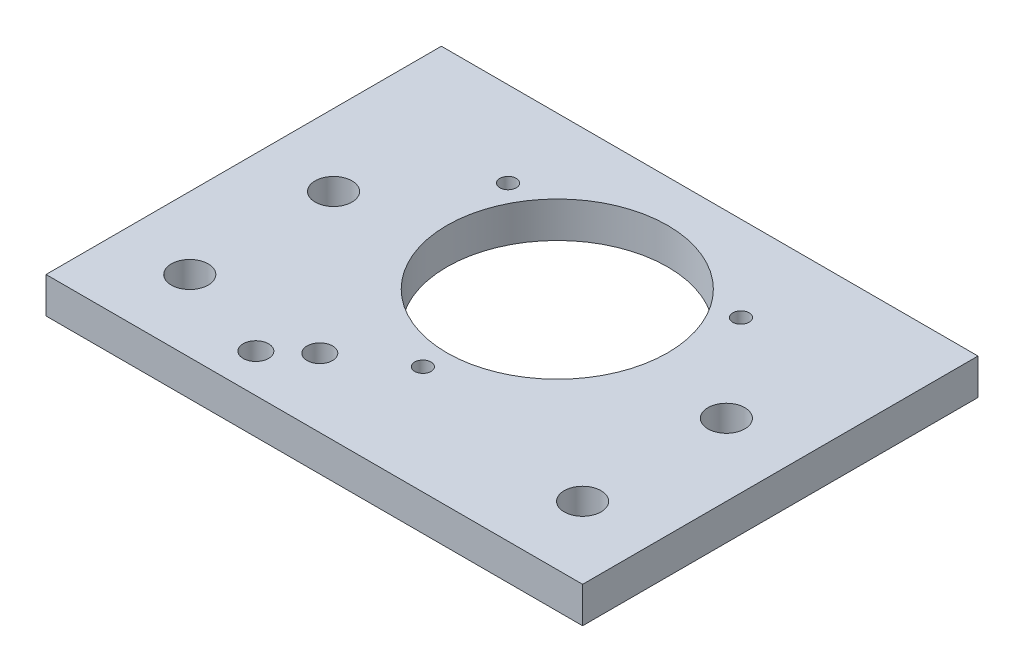
from build123d import *

# Parameters (mm, degrees)
SKETCH1_R           = 3.25755
SKETCH1_R_2         = 2.25
SKETCH1_R_3         = 1.45
SKETCH1_R_4         = 19.5
BOSS_EXTRUDE1_DEPTH = 6.35
SKETCH4_R           = 2.25
CUT_EXTRUDE2_DEPTH  = 3


with BuildPart() as part:
    # Sketch1 → Boss-Extrude1 (new body)
    with BuildSketch(Plane(origin=(0, 0, 0), x_dir=(1, 0, 0), z_dir=(0, 1, 0))):
        Polygon((47.4, 34.925), (-47.4, 34.925), (-47.4, -9.525), (-47.4, -34.925), (-22, -34.925), (47.4, -34.925), align=None)
        with Locations((-34.7, -22.225)):
            Circle(SKETCH1_R, mode=Mode.SUBTRACT)
        with Locations((-17.138337536, -28.111820997)):
            Circle(SKETCH1_R_2, mode=Mode.SUBTRACT)
        with Locations((-11.164910261, -22.79033938)):
            Circle(SKETCH1_R_2, mode=Mode.SUBTRACT)
        with Locations((0, -15.75)):
            Circle(SKETCH1_R_3, mode=Mode.SUBTRACT)
        with Locations((34.7, -22.225)):
            Circle(SKETCH1_R, mode=Mode.SUBTRACT)
        with Locations((-34.7, 3.175)):
            Circle(SKETCH1_R, mode=Mode.SUBTRACT)
        with Locations((0, 8)):
            Circle(SKETCH1_R_4, mode=Mode.SUBTRACT)
        with Locations((-20.56810334, 19.875)):
            Circle(SKETCH1_R_3, mode=Mode.SUBTRACT)
        with Locations((34.7, 3.175)):
            Circle(SKETCH1_R, mode=Mode.SUBTRACT)
        with Locations((20.56810334, 19.875)):
            Circle(SKETCH1_R_3, mode=Mode.SUBTRACT)
    extrude(amount=BOSS_EXTRUDE1_DEPTH)

    # Sketch4 → Cut-Extrude2 (cut)
    with BuildSketch(Plane.XZ):
        with BuildLine():
            Line((-8.171576852, 26.150392222), (-14.145004126, 31.471873838))
            ThreePointArc((-14.145004126, 31.471873838), (-20.498390378, 31.105154406), (-20.131670945, 24.751768155))
            Line((-20.131670945, 24.751768155), (-14.15824367, 19.430286538))
            ThreePointArc((-14.15824367, 19.430286538), (-7.804857419, 19.797005971), (-8.171576852, 26.150392222))
        make_face()
        with Locations((-11.164910261, 22.79033938)):
            Circle(SKETCH4_R, mode=Mode.SUBTRACT)
        with Locations((-17.138337536, 28.111820997)):
            Circle(SKETCH4_R, mode=Mode.SUBTRACT)
    extrude(amount=-CUT_EXTRUDE2_DEPTH, mode=Mode.SUBTRACT)


solid = part.part
